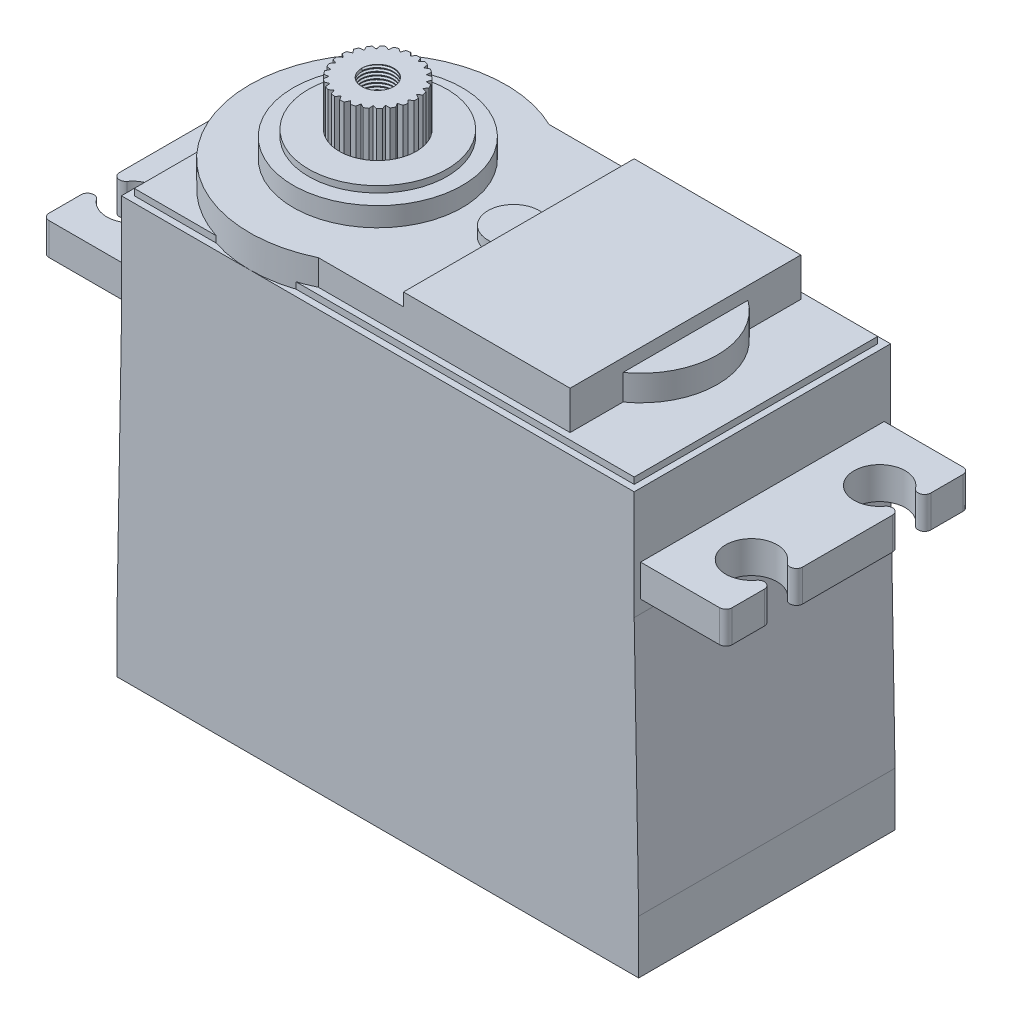
from build123d import *
from build123d.topology import SkipClean

# Parameters (mm, degrees)
SKETCH1_W                                        = 20
SKETCH1_H                                        = 8.5
BODY_1_DEPTH                                     = 10
SKETCH2_W                                        = 39
SKETCH2_H                                        = 19
BOSS_EXTRUDE3_DEPTH                              = 0.5
BOSS_EXTRUDE5_DEPTH                              = 0.5
BOSS_EXTRUDE6_START                              = 2
BOSS_EXTRUDE6_DEPTH                              = 2
SKETCH11_W                                       = 13
SKETCH11_H                                       = 18
BOSS_EXTRUDE7_DEPTH                              = 1
BOSS_EXTRUDE8_DEPTH                              = 0.8
SKETCH13_R                                       = 6.6
BOSS_EXTRUDE9_DEPTH                              = 1.5
SKETCH14_R                                       = 5.4
BOSS_EXTRUDE10_DEPTH                             = 0.5
SKETCH17_R                                       = 3
CUT_EXTRUDE1_DEPTH                               = 12
CHAMFER2_SIZE                                    = 2.82
CBORE_FOR_M2_PAN_HEAD_MACHINE_SCREW1_D           = 2.4
CBORE_FOR_M2_PAN_HEAD_MACHINE_SCREW1_DEPTH       = 8
CBORE_FOR_M2_PAN_HEAD_MACHINE_SCREW1_CBORE_D     = 5
CBORE_FOR_M2_PAN_HEAD_MACHINE_SCREW1_CBORE_DEPTH = 1.6
CBORE_FOR_M2_PAN_HEAD_MACHINE_SCREW1_TIP         = 0.721032743
SKETCH21_R                                       = 3
BOSS_EXTRUDE11_DEPTH                             = 10.5
BOSS_EXTRUDE16_DEPTH                             = 5
SKETCH23_W                                       = 19
SKETCH23_H                                       = 2.5
BOSS_EXTRUDE17_DEPTH                             = 6.65
FILLET1_R                                        = 0.5
CUT_EXTRUDE2_DEPTH                               = 7
SKETCH29_W                                       = 19
SKETCH29_H                                       = 2.5
BOSS_EXTRUDE19_DEPTH                             = 6.65
CUT_EXTRUDE6_DEPTH                               = 6.65
FILLET2_R                                        = 0.5
SKETCH34_R                                       = 1.25
CUT_EXTRUDE7_DEPTH                               = 8
THREAD1_PITCH                                    = 0.25


with BuildPart() as part:
    # Sketch1 → Body 1 (new, symmetric)
    with BuildSketch(Plane.XY):
        Polygon((20.349101299, 26.994041123), (20.349101299, 0), (40.698202597, 0), (40.698202597, 1.994041123), (40.698202597, 6.994041123), (40.349101299, 26.994041123), align=None)
        Polygon((0, 6.994041123), (0, 1.994041123), (0, 0), (20.349101299, 0), (20.349101299, 26.994041123), (0.349101299, 26.994041123), align=None)
        with Locations((10.349101299, 31.244041123)):
            Rectangle(SKETCH1_W, SKETCH1_H)
        with Locations((30.349101299, 31.244041123)):
            Rectangle(SKETCH1_W, SKETCH1_H)
    extrude(amount=BODY_1_DEPTH, both=True)

    # Sketch2 → Boss-Extrude3 (add)
    with BuildSketch(Plane(origin=(0, 35.494041123, 0), x_dir=(1, 0, 0), z_dir=(0, 1, 0))):
        with Locations((20.349101299, 0)):
            Rectangle(SKETCH2_W, SKETCH2_H)
    extrude(amount=BOSS_EXTRUDE3_DEPTH)

    # Sketch3 → Boss-Extrude5 (add)
    with BuildSketch(Plane(origin=(0, 35.994041123, 0), x_dir=(1, 0, 0), z_dir=(0, 1, 0))):
        with BuildLine():
            ThreePointArc((0.849101299, 3.122498999), (0.349101299, 0), (0.849101299, -3.122498999))
            Line((0.849101299, -3.122498999), (0.849101299, 3.122498999))
        make_face()
        with BuildLine():
            ThreePointArc((13.471600298, 9.5), (10.349101299, 10), (7.226602299, 9.5))
            Line((7.226602299, 9.5), (13.471600298, 9.5))
        make_face()
        with BuildLine():
            Line((13.471600298, -9.5), (7.226602299, -9.5))
            ThreePointArc((7.226602299, -9.5), (10.349101299, -10), (13.471600298, -9.5))
        make_face()
    extrude(amount=-BOSS_EXTRUDE5_DEPTH)

    # Sketch8 → Boss-Extrude6 (add)
    with BuildSketch(Plane(origin=(0, 35.994041123, 0), x_dir=(1, 0, 0), z_dir=(0, 1, 0)).offset(BOSS_EXTRUDE6_START)):
        with BuildLine():
            Line((14.708000242, -9), (34.349101299, -9))
            Line((34.349101299, -9), (34.349101299, 9))
            Line((34.349101299, 9), (14.708000242, 9))
            ThreePointArc((14.708000242, 9), (0.349101299, 0), (14.708000242, -9))
        make_face()
        with BuildLine():
            Line((34.349101299, -4.873397172), (34.349101299, 4.873397172))
            ThreePointArc((34.349101299, 4.873397172), (36.849101299, 0), (34.349101299, -4.873397172))
        make_face()
    extrude(amount=-BOSS_EXTRUDE6_DEPTH)

    # Sketch11 → Boss-Extrude7 (add)
    with BuildSketch(Plane(origin=(0, 37.994041123, 0), x_dir=(1, 0, 0), z_dir=(0, 1, 0))):
        with Locations((27.849101299, 0)):
            Rectangle(SKETCH11_W, SKETCH11_H)
    extrude(amount=BOSS_EXTRUDE7_DEPTH)

    # Sketch12 → Boss-Extrude8 (add)
    with BuildSketch(Plane(origin=(0, 37.994041123, 0), x_dir=(1, 0, 0), z_dir=(0, 1, 0))):
        with BuildLine():
            ThreePointArc((21.349101299, 1.959591794), (18.949101299, 0), (21.349101299, -1.959591794))
            Line((21.349101299, -1.959591794), (21.349101299, 0))
            Line((21.349101299, 0), (21.349101299, 1.959591794))
        make_face()
    extrude(amount=BOSS_EXTRUDE8_DEPTH)

    # Sketch13 → Boss-Extrude9 (add)
    with BuildSketch(Plane(origin=(0, 37.994041123, 0), x_dir=(1, 0, 0), z_dir=(0, 1, 0))):
        with Locations(Location((10.349101299, 0, 0), (0, 0, 180))):
            Circle(SKETCH13_R)
    extrude(amount=BOSS_EXTRUDE9_DEPTH)

    # Sketch14 → Boss-Extrude10 (add)
    with BuildSketch(Plane(origin=(0, 39.494041123, 0), x_dir=(1, 0, 0), z_dir=(0, 1, 0))):
        with Locations(Location((10.349101299, 0, 0), (0, 0, 180))):
            Circle(SKETCH14_R)
    extrude(amount=BOSS_EXTRUDE10_DEPTH)

    # Sketch17 → Cut-Extrude1 (cut)
    with BuildSketch(Plane(origin=(0, 39.994041123, 0), x_dir=(1, 0, 0), z_dir=(0, 1, 0))):
        with Locations(Location((10.349101299, 0, 0), (0, 0, 180))):
            Circle(SKETCH17_R)
    extrude(amount=-CUT_EXTRUDE1_DEPTH, mode=Mode.SUBTRACT)

    # Chamfer2
    chamfer2_edges = [part.edges().sort_by_distance(p)[0] for p in [
        (20.349101299, 0, -10),
        (40.698202597, 0, 0),
        (0, 0, 0),
        (20.349101299, 0, 10),
    ]]
    chamfer(chamfer2_edges, length=CHAMFER2_SIZE)

    # CBORE for M2 Pan Head Machine Screw1
    with Locations(Plane(origin=(0, 0, 0), x_dir=(-1, 0, 0), z_dir=(0, -1, 0))):
        with Locations((-38.698202597, 8), (-2, 8), (-2, -8), (-38.698202597, -8)):
            CounterBoreHole(CBORE_FOR_M2_PAN_HEAD_MACHINE_SCREW1_D / 2, CBORE_FOR_M2_PAN_HEAD_MACHINE_SCREW1_CBORE_D / 2, CBORE_FOR_M2_PAN_HEAD_MACHINE_SCREW1_CBORE_DEPTH, depth=CBORE_FOR_M2_PAN_HEAD_MACHINE_SCREW1_DEPTH)
            with Locations((0, 0, -(CBORE_FOR_M2_PAN_HEAD_MACHINE_SCREW1_DEPTH + CBORE_FOR_M2_PAN_HEAD_MACHINE_SCREW1_TIP / 2))):  # 118° drill point
                Cone(0, CBORE_FOR_M2_PAN_HEAD_MACHINE_SCREW1_D / 2, CBORE_FOR_M2_PAN_HEAD_MACHINE_SCREW1_TIP, mode=Mode.SUBTRACT)

    # Sketch23 → Boss-Extrude17 (add)
    with BuildSketch(Plane(origin=(40.349101299, 0, 0), x_dir=(0, 0, -1), z_dir=(1, 0, 0))):
        with Locations((0, 29.244041123)):
            Rectangle(SKETCH23_W, SKETCH23_H)
    extrude(amount=BOSS_EXTRUDE17_DEPTH)

    # Fillet1
    fillet1_edges = [part.edges().sort_by_distance(p)[0] for p in [
        (46.999101299, 29.244041123, 9.5),
        (46.999101299, 29.244041123, -9.5),
    ]]
    fillet(fillet1_edges, radius=FILLET1_R)

    # Sketch25 → Cut-Extrude2 (cut)
    with BuildSketch(Plane(origin=(0, 30.494041123, 0), x_dir=(1, 0, 0), z_dir=(0, 1, 0))):
        with BuildLine():
            Line((46.999101299, 6.5), (46.999101299, 3.5))
            ThreePointArc((46.999101299, 3.5), (46.657215182, 3.974341649), (46.099101299, 3.8))
            ThreePointArc((46.099101299, 3.8), (42.499101299, 5), (46.099101299, 6.2))
            ThreePointArc((46.099101299, 6.2), (46.657215182, 6.025658351), (46.999101299, 6.5))
        make_face()
        with BuildLine():
            Line((46.999101299, -3.5), (46.999101299, -6.5))
            ThreePointArc((46.999101299, -6.5), (46.657215182, -6.025658351), (46.099101299, -6.2))
            ThreePointArc((46.099101299, -6.2), (42.499101299, -5), (46.099101299, -3.8))
            ThreePointArc((46.099101299, -3.8), (46.657215182, -3.974341649), (46.999101299, -3.5))
        make_face()
    extrude(amount=-CUT_EXTRUDE2_DEPTH, mode=Mode.SUBTRACT)

    # Sketch29 → Boss-Extrude19 (add)
    with BuildSketch(Plane.ZY.offset(-0.349101299)):
        with Locations((0, 29.244041123)):
            Rectangle(SKETCH29_W, SKETCH29_H)
    extrude(amount=BOSS_EXTRUDE19_DEPTH)

    # Sketch31 → Cut-Extrude6 (cut)
    with BuildSketch(Plane.XZ.offset(-27.994041123)):
        with BuildLine():
            Line((-6.300898701, -6.5), (-6.300898701, -3.5))
            ThreePointArc((-6.300898701, -3.5), (-5.959012584, -3.974341649), (-5.400898701, -3.8))
            ThreePointArc((-5.400898701, -3.8), (-1.800898701, -5), (-5.400898701, -6.2))
            ThreePointArc((-5.400898701, -6.2), (-5.959012584, -6.025658351), (-6.300898701, -6.5))
        make_face()
        with BuildLine():
            Line((-6.300898701, 6.5), (-6.300898701, 3.5))
            ThreePointArc((-6.300898701, 3.5), (-5.959012584, 3.974341649), (-5.400898701, 3.8))
            ThreePointArc((-5.400898701, 3.8), (-1.800898701, 5), (-5.400898701, 6.2))
            ThreePointArc((-5.400898701, 6.2), (-5.959012584, 6.025658351), (-6.300898701, 6.5))
        make_face()
    extrude(amount=-CUT_EXTRUDE6_DEPTH, mode=Mode.SUBTRACT)

    # Fillet2
    fillet2_edges = [part.edges().sort_by_distance(p)[0] for p in [
        (-6.300898701, 29.244041123, -9.5),
        (-6.300898701, 29.244041123, 9.5),
    ]]
    fillet(fillet2_edges, radius=FILLET2_R)


with BuildPart() as body_2:
    # Sketch21 → Boss-Extrude11 (new body)
    with BuildSketch(Plane(origin=(0, 27.994041123, 0), x_dir=(1, 0, 0), z_dir=(0, 1, 0))):
        with Locations((10.349101299, 0)):
            Circle(SKETCH21_R)
    extrude(amount=BOSS_EXTRUDE11_DEPTH)

    # Boss-Extrude16: read off the stored shape, not the designer's step
    # Boss-Extrude16 outline → Boss-Extrude16 (add)
    with BuildSketch(Plane(origin=(0, 38.494041123, 0), x_dir=(1, 0, 0), z_dir=(0, 1, 0))):
        with BuildLine():
            Line((7.35816942, 0.21203453), (7.649101299, 0))
            Line((7.649101299, 0), (7.35816942, -0.21203453))
            ThreePointArc((7.35816942, -0.21203453), (7.374306596, -0.375803966), (7.399404201, -0.538441436))
            Line((7.399404201, -0.538441436), (7.733926764, -0.671462695))
            Line((7.733926764, -0.671462695), (7.504865888, -0.949187587))
            ThreePointArc((7.504865888, -0.949187587), (7.561223887, -1.103798752), (7.6259793, -1.255085146))
            Line((7.6259793, -1.255085146), (7.983073262, -1.30073492))
            Line((7.983073262, -1.30073492), (7.830276128, -1.626699697))
            ThreePointArc((7.830276128, -1.626699697), (7.92331377, -1.762437803), (8.023658168, -1.892867241))
            Line((8.023658168, -1.892867241), (8.380886005, -1.848277186))
            Line((8.380886005, -1.848277186), (8.313953416, -2.202000282))
            ThreePointArc((8.313953416, -2.202000282), (8.437824804, -2.310336406), (8.567453181, -2.411713526))
            Line((8.567453181, -2.411713526), (8.902368952, -2.279685399))
            Line((8.902368952, -2.279685399), (8.925506531, -2.638941091))
            ThreePointArc((8.925506531, -2.638941091), (9.07242837, -2.713068075), (9.223195697, -2.77902298))
            Line((9.223195697, -2.77902298), (9.514755414, -2.567852594))
            Line((9.514755414, -2.567852594), (9.626509341, -2.910067526))
            ThreePointArc((9.626509341, -2.910067526), (9.787249991, -2.945327699), (9.949683004, -2.9717162))
            Line((9.949683004, -2.9717162), (10.179566896, -2.694672167))
            Line((10.179566896, -2.694672167), (10.37291526, -2.998343716))
            ThreePointArc((10.37291526, -2.998343716), (10.537374796, -2.992521551), (10.70126723, -2.977685561))
            Line((10.70126723, -2.977685561), (10.855030848, -2.652175577))
            Line((10.855030848, -2.652175577), (11.117824861, -2.898222943))
            ThreePointArc((11.117824861, -2.898222943), (11.275669685, -2.851684269), (11.430723576, -2.796555988))
            Line((11.430723576, -2.796555988), (11.498705386, -2.443033042))
            Line((11.498705386, -2.443033042), (11.814432734, -2.615996164))
            ThreePointArc((11.814432734, -2.615996164), (11.955744874, -2.531665176), (12.092217616, -2.439708517))
            Line((12.092217616, -2.439708517), (12.070146071, -2.080385755))
            Line((12.070146071, -2.080385755), (12.418968443, -2.169396725))
            ThreePointArc((12.418968443, -2.169396725), (12.534868739, -2.05257225), (12.644185248, -1.929565187))
            Line((12.644185248, -1.929565187), (12.533447183, -1.587020181))
            Line((12.533447183, -1.587020181), (12.893446787, -1.586486111))
            ThreePointArc((12.893446787, -1.586486111), (12.976652797, -1.44450866), (13.051944314, -1.29818018))
            Line((13.051944314, -1.29818018), (12.85949781, -0.993936292))
            Line((12.85949781, -0.993936292), (13.208054547, -0.90389074))
            ThreePointArc((13.208054547, -0.90389074), (13.25333813, -0.745681279), (13.289873813, -0.585225738))
            Line((13.289873813, -0.585225738), (13.027810992, -0.338399731))
            Line((13.027810992, -0.338399731), (13.343023759, -0.164500589))
            ThreePointArc((13.343023759, -0.164500589), (13.347539583, 0), (13.343023759, 0.164500589))
            Line((13.343023759, 0.164500589), (13.027810992, 0.338399731))
            Line((13.027810992, 0.338399731), (13.289873813, 0.585225738))
            ThreePointArc((13.289873813, 0.585225738), (13.25333813, 0.745681279), (13.208054547, 0.90389074))
            Line((13.208054547, 0.90389074), (12.85949781, 0.993936292))
            Line((12.85949781, 0.993936292), (13.051944314, 1.29818018))
            ThreePointArc((13.051944314, 1.29818018), (12.976652797, 1.44450866), (12.893446787, 1.586486111))
            Line((12.893446787, 1.586486111), (12.533447183, 1.587020181))
            Line((12.533447183, 1.587020181), (12.644185248, 1.929565187))
            ThreePointArc((12.644185248, 1.929565187), (12.534868739, 2.05257225), (12.418968443, 2.169396725))
            Line((12.418968443, 2.169396725), (12.070146071, 2.080385755))
            Line((12.070146071, 2.080385755), (12.092217616, 2.439708517))
            ThreePointArc((12.092217616, 2.439708517), (11.955744874, 2.531665176), (11.814432734, 2.615996164))
            Line((11.814432734, 2.615996164), (11.498705386, 2.443033042))
            Line((11.498705386, 2.443033042), (11.430723576, 2.796555988))
            ThreePointArc((11.430723576, 2.796555988), (11.275669685, 2.851684269), (11.117824861, 2.898222943))
            Line((11.117824861, 2.898222943), (10.855030848, 2.652175577))
            Line((10.855030848, 2.652175577), (10.70126723, 2.977685561))
            ThreePointArc((10.70126723, 2.977685561), (10.537374796, 2.992521551), (10.37291526, 2.998343716))
            Line((10.37291526, 2.998343716), (10.179566896, 2.694672167))
            Line((10.179566896, 2.694672167), (9.949683004, 2.9717162))
            ThreePointArc((9.949683004, 2.9717162), (9.787249991, 2.945327699), (9.626509341, 2.910067526))
            Line((9.626509341, 2.910067526), (9.514755414, 2.567852594))
            Line((9.514755414, 2.567852594), (9.223195697, 2.77902298))
            ThreePointArc((9.223195697, 2.77902298), (9.07242837, 2.713068075), (8.925506531, 2.638941091))
            Line((8.925506531, 2.638941091), (8.902368952, 2.279685399))
            Line((8.902368952, 2.279685399), (8.567453181, 2.411713526))
            ThreePointArc((8.567453181, 2.411713526), (8.437824804, 2.310336406), (8.313953416, 2.202000282))
            Line((8.313953416, 2.202000282), (8.380886005, 1.848277186))
            Line((8.380886005, 1.848277186), (8.023658168, 1.892867241))
            ThreePointArc((8.023658168, 1.892867241), (7.92331377, 1.762437803), (7.830276128, 1.626699697))
            Line((7.830276128, 1.626699697), (7.983073262, 1.30073492))
            Line((7.983073262, 1.30073492), (7.6259793, 1.255085146))
            ThreePointArc((7.6259793, 1.255085146), (7.561223887, 1.103798752), (7.504865888, 0.949187587))
            Line((7.504865888, 0.949187587), (7.733926764, 0.671462695))
            Line((7.733926764, 0.671462695), (7.399404201, 0.538441436))
            ThreePointArc((7.399404201, 0.538441436), (7.374306596, 0.375803966), (7.35816942, 0.21203453))
        make_face()
    extrude(amount=BOSS_EXTRUDE16_DEPTH)

    # Sketch34 → Cut-Extrude7 (cut)
    with BuildSketch(Plane(origin=(0, 43.494041123, 0), x_dir=(1, 0, 0), z_dir=(0, 1, 0))):
        with Locations(Location((10.349101299, 0, 0), (0, 0, 270))):
            Circle(SKETCH34_R)
    extrude(amount=-CUT_EXTRUDE7_DEPTH, mode=Mode.SUBTRACT)

    # Thread1: arcs per turn and ends read off the stored shape
    # Thread1: the profile of Thread Profile1 profile screwed along a right-hand helix through 32 turns, 6 arcs to a turn; built about Z, then put on its axis
    with SkipClean():  # the faces are left unmerged after this step: merging them gives an invalid solid
        thread1_z = Axis((0, 0, 0), (0, 0, 1))
        thread1_corners = [(1.2497, 0, -0.000173205), (1.385316469, 0, 0.078125), (1.385316469, 0, 0.109375), (1.2497, 0, 0.187673204)]
        with BuildLine(mode=Mode.PRIVATE) as thread1_profile:
            Line(thread1_corners[0], thread1_corners[1])
            Line(thread1_corners[1], thread1_corners[2])
            Line(thread1_corners[2], thread1_corners[3])
            Line(thread1_corners[3], thread1_corners[0])
        thread1_cap = Face(thread1_profile.wire())
        thread1_turn_angles = [0, 30, 60, 90, 120, 150, 180, 210, 240, 270, 300, 330, 360]
        thread1_turn_weights = [1, 0.8660254037844387, 1, 0.8660254037844387, 1, 0.8660254037844387, 1, 0.8660254037844387, 1, 0.8660254037844387, 1, 0.8660254037844387, 1]
        thread1_turn_rails = [Edge.make_bspline([Vector(p[0], p[1], 0).rotate(thread1_z, thread1_turn_angles[k]) / thread1_turn_weights[k] + Vector(0, 0, p[2] + THREAD1_PITCH * thread1_turn_angles[k] / 360) for k in range(13)], [0, 0, 0, 1, 1, 2, 2, 3, 3, 4, 4, 5, 5, 6, 6, 6], 2, thread1_turn_weights) for p in thread1_corners]
        thread1_turn_sides = [Face.make_surface_from_curves(thread1_turn_rails[p[0]], thread1_turn_rails[p[1]]) for p in [(0, 1), (1, 2), (2, 3), (3, 0)]]
        thread1 = Plane(origin=(10.349101299, 43.494041123, 0), x_dir=(-1, 0, 0), z_dir=(0, -1, 0)) * Solid(Shell([*[p.moved(Location((0, 0, THREAD1_PITCH * i))) for i in range(32) for p in thread1_turn_sides], thread1_cap, thread1_cap.rotate(thread1_z, 11520).moved(Location((0, 0, THREAD1_PITCH * 11520 / 360)))]))
        add(thread1, mode=Mode.SUBTRACT)


solid = Compound([part.part, body_2.part])
